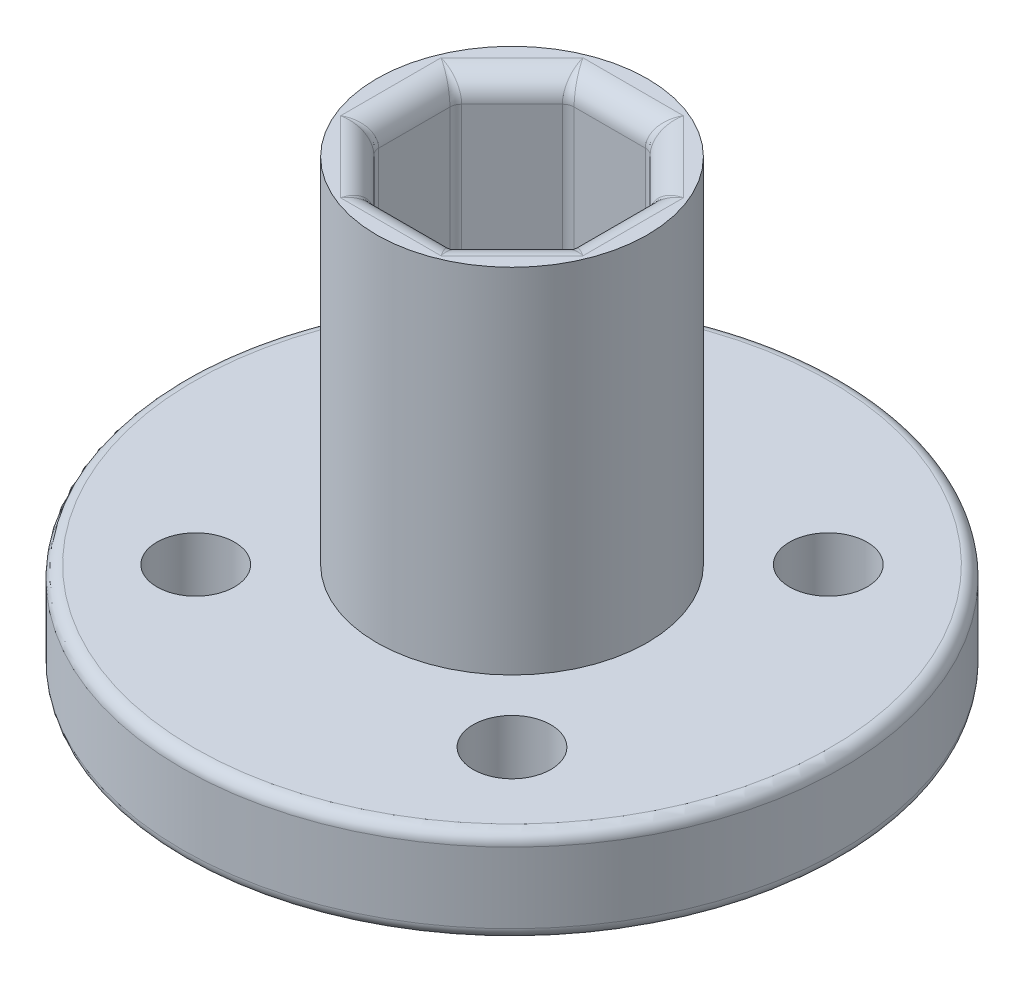
from build123d import *

# Parameters (mm, degrees)
SKETCH1_R           = 14
BOSS_EXTRUDE1_DEPTH = 4
SKETCH3_R           = 5.75
BOSS_EXTRUDE2_DEPTH = 15
CUT_EXTRUDE3_DEPTH  = 28.440845468
SKETCH5_R           = 1.65
CUT_EXTRUDE2_DEPTH  = 28.440845468
CHAMFER1_SIZE       = 1.6
FILLET1_R           = 1
FILLET2_R           = 0.5


with BuildPart() as part:
    # Sketch1 → Boss-Extrude1 (new body)
    with BuildSketch(Plane(origin=(0, 0, 0), x_dir=(1, 0, 0), z_dir=(0, 1, 0))):
        Circle(SKETCH1_R)
    extrude(amount=BOSS_EXTRUDE1_DEPTH)

    # Sketch3 → Boss-Extrude2 (add)
    with BuildSketch(Plane(origin=(0, 4, 0), x_dir=(1, 0, 0), z_dir=(0, 1, 0))):
        Circle(SKETCH3_R)
    extrude(amount=BOSS_EXTRUDE2_DEPTH)

    # Sketch6 → Cut-Extrude3 (cut, through all)
    with BuildSketch(Plane(origin=(0, 19, 0), x_dir=(1, 0, 0), z_dir=(0, 1, 0))):
        Polygon((1.718986284, 4.15), (-1.718986284, 4.15), (-4.15, 1.718986284), (-4.15, -1.718986284), (-1.718986284, -4.15), (1.718986284, -4.15), (4.15, -1.718986284), (4.15, 1.718986284), align=None)
    extrude(amount=-CUT_EXTRUDE3_DEPTH, mode=Mode.SUBTRACT)

    # Sketch5 → Cut-Extrude2 (cut, through all)
    with BuildSketch(Plane.XZ):
        with Locations((6.717514421, 6.717514421)):
            Circle(SKETCH5_R)
        with Locations((-6.717514421, 6.717514421)):
            Circle(SKETCH5_R)
        with Locations((-6.717514421, -6.717514421)):
            Circle(SKETCH5_R)
        with Locations((6.717514421, -6.717514421)):
            Circle(SKETCH5_R)
    extrude(amount=-CUT_EXTRUDE2_DEPTH, mode=Mode.SUBTRACT)

    # Chamfer1
    chamfer1_edges = [part.edges().sort_by_distance(p)[0] for p in [
        (5.067514421, 0, -6.717514421),
        (-8.367514421, 0, -6.717514421),
        (5.067514421, 0, 6.717514421),
        (-8.367514421, 0, 6.717514421),
    ]]
    chamfer(chamfer1_edges, length=CHAMFER1_SIZE)

    # Fillet1
    fillet1_edges = [part.edges().sort_by_distance(p)[0] for p in [
        (0, 19, 4.15),
        (-2.934493142, 19, 2.934493142),
        (-4.15, 19, 0),
        (-2.934493142, 19, -2.934493142),
        (0, 19, -4.15),
        (2.934493142, 19, -2.934493142),
        (4.15, 19, 0),
        (2.934493142, 19, 2.934493142),
    ]]
    fillet(fillet1_edges, radius=FILLET1_R)

    # Fillet2
    fillet2_edges = [part.edges().sort_by_distance(p)[0] for p in [
        (-14, 0, 0),
        (-14, 4, 0),
        (-1.718986284, 9, -4.15),
        (-4.15, 9, -1.718986284),
        (-4.15, 9, 1.718986284),
        (-1.718986284, 9, 4.15),
        (1.718986284, 9, 4.15),
        (4.15, 9, 1.718986284),
        (4.15, 9, -1.718986284),
        (1.718986284, 9, -4.15),
        (-1.846147132, 18.720931282, -4.456993444),
        (-4.456993444, 18.720931282, -1.846147132),
        (-4.456993444, 18.720931282, 1.846147132),
        (-1.846147132, 18.720931282, 4.456993444),
        (1.846147132, 18.720931282, 4.456993444),
        (4.456993444, 18.720931282, 1.846147132),
        (4.456993444, 18.720931282, -1.846147132),
        (1.846147132, 18.720931282, -4.456993444),
    ]]
    fillet(fillet2_edges, radius=FILLET2_R)


solid = part.part
